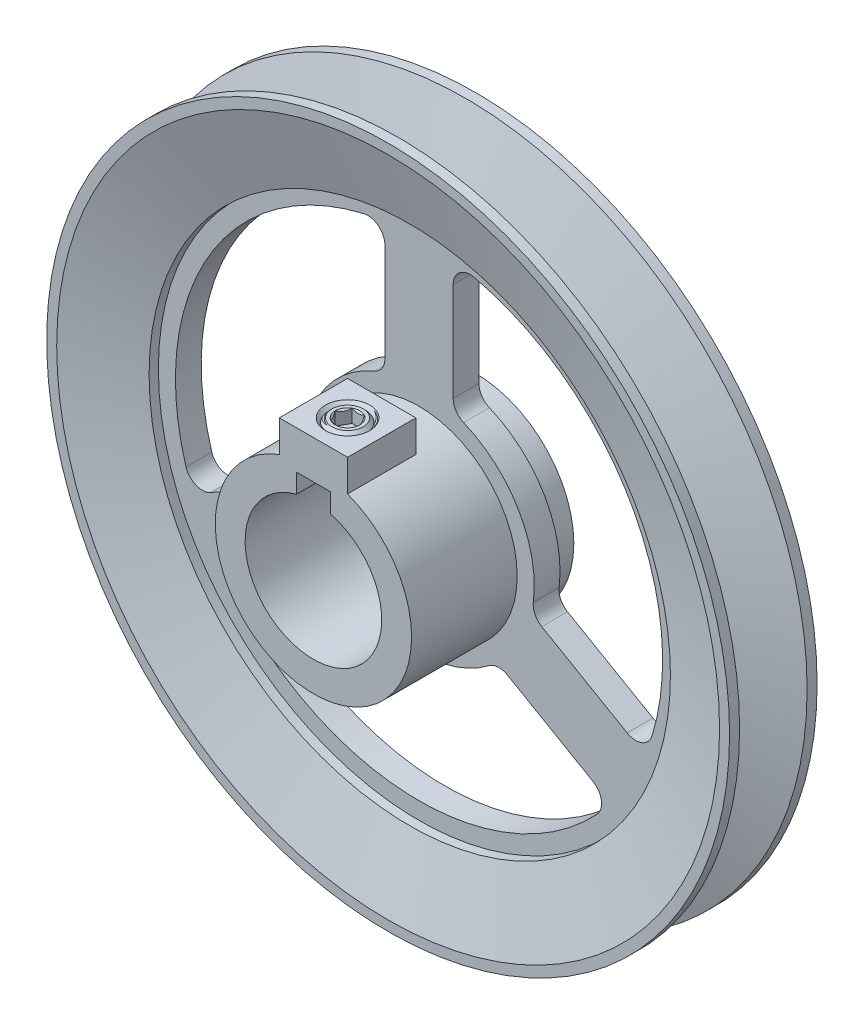
from build123d import *

# Parameters (mm, degrees)
CUT_EXTRUDE1_DEPTH       = 16.2814
CIRPATTERN1_COUNT        = 3
SKETCH3_R                = 12.7
CUT_EXTRUDE2_DEPTH       = 30.1752
SKETCH4_W                = 6.35
SKETCH4_H                = 6.35
CUT_EXTRUDE3_DEPTH       = 30.1752
BOSS_EXTRUDE1_REACH      = 112.601
BOSS_EXTRUDE1_END_RADIUS = 18.25625
BOSS_EXTRUDE1_START      = 4.7625
SKETCH5_W                = 12.7
SKETCH5_H                = 12.7
SKETCH6_R                = 3.086805556
CUT_EXTRUDE4_DEPTH       = 23.01875
CUT_SWEEP1_PITCH         = 1.411111111
CUT_SWEEP2_PITCH         = 1.411111111
CUT_EXTRUDE6_DEPTH       = 2.48046875


with BuildPart() as part:
    # Sketch1 → Revolve1 (revolve)
    with BuildSketch(Plane(origin=(0, 0, 0), x_dir=(0, 0, -1), z_dir=(1, 0, 0)), mode=Mode.PRIVATE) as revolve1_sk:
        Polygon((6.279294914, 63.5), (8.1407, 63.5), (8.1407, 61.638594914), (4.116401395, 48.475707285), (2.396515259, 48.475707285), (2.396515259, 18.25625), (8.1407, 18.25625), (8.1407, 0), (-22.0345, 0), (-22.0345, 18.25625), (-7.747, 18.25625), (-2.396515259, 18.25625), (-2.396515259, 48.475707285), (-4.116401395, 48.475707285), (-8.1407, 61.638594914), (-8.1407, 63.5), (-6.279294914, 63.5), (-2.396515259, 50.8), (2.396515259, 50.8), align=None)
    revolve(revolve1_sk.sketch.rotate(Axis((0, 0, 22.0345), (0, 0, -1)), 90), axis=Axis((0, 0, 22.0345), (0, 0, -1)))

    # Sketch2 → Cut-Extrude1 (cut)
    with BuildSketch(Plane(origin=(0, -7.9375, -8.1407), x_dir=(0, 1, 0), z_dir=(0, 0, 1))):
        with BuildLine():
            Line((-7.080606873, -38.712124137), (2.092799109, -22.823318899))
            ThreePointArc((2.092799109, -22.823318899), (3.43135905, -21.566613485), (5.241793667, -21.261035815))
            ThreePointArc((5.241793667, -21.261035815), (18.653125, -18.560006935), (27.697950293, -8.295967742))
            ThreePointArc((27.697950293, -8.295967742), (28.867805627, -6.880874207), (30.625424411, -6.35))
            Line((30.625424411, -6.35), (48.972236374, -6.35))
            ThreePointArc((48.972236374, -6.35), (51.458191388, -7.549992996), (52.065010273, -10.242895958))
            ThreePointArc((52.065010273, -10.242895958), (30.587853642, -39.231563318), (-5.255647028, -43.336992881))
            ThreePointArc((-5.255647028, -43.336992881), (-7.284359961, -41.46502083), (-7.080606873, -38.712124137))
        make_face()
    cut_extrude1 = extrude(amount=CUT_EXTRUDE1_DEPTH, mode=Mode.SUBTRACT)

    # CirPattern1: Cut-Extrude1 ×3 about axis
    cirpattern1_axis = Axis((0, 0, 0), (0, 0, 1))
    for i in range(1, CIRPATTERN1_COUNT):
        add(cut_extrude1.rotate(cirpattern1_axis, i * 360 / CIRPATTERN1_COUNT), mode=Mode.SUBTRACT)

    # Sketch3 → Cut-Extrude2 (cut)
    with BuildSketch(Plane(origin=(0, 0, -8.1407), x_dir=(-1, 0, 0), z_dir=(0, 0, -1))):
        with Locations(Location((0, 0, 0), (0, 0, 90))):
            Circle(SKETCH3_R)
    extrude(amount=-CUT_EXTRUDE2_DEPTH, mode=Mode.SUBTRACT)

    # Sketch4 → Cut-Extrude3 (cut)
    with BuildSketch(Plane(origin=(0, 0, -8.1407), x_dir=(-1, 0, 0), z_dir=(0, 0, -1))):
        with Locations((0, 12.7)):
            Rectangle(SKETCH4_W, SKETCH4_H)
    extrude(amount=-CUT_EXTRUDE3_DEPTH, mode=Mode.SUBTRACT)

    # Boss-Extrude1: up to this cylinder (the profile starts outside it)
    boss_extrude1_end = Plane(origin=(0, 0, 15.6845), z_dir=(0, 0, 1)) * Cylinder(BOSS_EXTRUDE1_END_RADIUS, 262.7145, mode=Mode.PRIVATE)
    # Sketch5 → Boss-Extrude1 (add, up to the surface)
    with BuildSketch(Plane(origin=(0, 18.25625, 0), x_dir=(-1, 0, 0), z_dir=(0, 1, 0)).offset(BOSS_EXTRUDE1_START), mode=Mode.PRIVATE) as boss_extrude1_sk1:
        with Locations((0, 15.6845)):
            Rectangle(SKETCH5_W, SKETCH5_H)
    boss_extrude1_tool1 = extrude(boss_extrude1_sk1.sketch, amount=-BOSS_EXTRUDE1_REACH, mode=Mode.PRIVATE) - boss_extrude1_end
    add(boss_extrude1_tool1.solids().sort_by_distance((0, 23.01875, 15.6845))[0])

    # Sketch6 → Cut-Extrude4 (cut)
    with BuildSketch(Plane(origin=(0, 23.01875, 0), x_dir=(-1, 0, 0), z_dir=(0, 1, 0))):
        with Locations(Location((0, 15.6845, 0), (0, 0, 90))):
            Circle(SKETCH6_R)
    extrude(amount=-CUT_EXTRUDE4_DEPTH, mode=Mode.SUBTRACT)

    # Cut-Sweep1: arcs per turn and ends read off the stored shape
    # Cut-Sweep1: the profile of Sketch8 screwed along a right-hand helix through 13.9375 turns, 8 arcs to a turn; built about Z, then put on its axis
    cut_sweep1_z = Axis((0, 0, 0), (0, 0, 1))
    cut_sweep1_corners = [(2.975827818, 0, -1.367013889), (2.975827818, 0, -0.044097222), (3.96875, 0, -0.617361111), (3.96875, 0, -0.79375)]
    with BuildLine(mode=Mode.PRIVATE) as cut_sweep1_profile:
        Line(cut_sweep1_corners[0], cut_sweep1_corners[1])
        Line(cut_sweep1_corners[1], cut_sweep1_corners[2])
        Line(cut_sweep1_corners[2], cut_sweep1_corners[3])
        Line(cut_sweep1_corners[3], cut_sweep1_corners[0])
    cut_sweep1_cap = Face(cut_sweep1_profile.wire())
    cut_sweep1_turn_angles = [0, 22.5, 45, 67.5, 90, 112.5, 135, 157.5, 180, 202.5, 225, 247.5, 270, 292.5, 315, 337.5, 360]
    cut_sweep1_turn_weights = [1, 0.9238795325112867, 1, 0.9238795325112867, 1, 0.9238795325112867, 1, 0.9238795325112867, 1, 0.9238795325112867, 1, 0.9238795325112867, 1, 0.9238795325112867, 1, 0.9238795325112867, 1]
    cut_sweep1_turn_rails = [Edge.make_bspline([Vector(p[0], p[1], 0).rotate(cut_sweep1_z, cut_sweep1_turn_angles[k]) / cut_sweep1_turn_weights[k] + Vector(0, 0, p[2] + CUT_SWEEP1_PITCH * cut_sweep1_turn_angles[k] / 360) for k in range(17)], [0, 0, 0, 1, 1, 2, 2, 3, 3, 4, 4, 5, 5, 6, 6, 7, 7, 8, 8, 8], 2, cut_sweep1_turn_weights) for p in cut_sweep1_corners]
    cut_sweep1_turn_sides = [Face.make_surface_from_curves(cut_sweep1_turn_rails[p[0]], cut_sweep1_turn_rails[p[1]]) for p in [(0, 1), (1, 2), (2, 3), (3, 0)]]
    cut_sweep1_last_angles = [4680, 4702.5, 4725, 4747.5, 4770, 4792.5, 4815, 4837.5, 4860, 4882.5, 4905, 4927.5, 4950, 4972.5, 4995, 5006.25, 5017.5]
    cut_sweep1_last_weights = [1, 0.9238795325112867, 1, 0.9238795325112867, 1, 0.9238795325112867, 1, 0.9238795325112867, 1, 0.9238795325112867, 1, 0.9238795325112867, 1, 0.9238795325112867, 1, 0.9807852804032211, 1]
    cut_sweep1_last_rails = [Edge.make_bspline([Vector(p[0], p[1], 0).rotate(cut_sweep1_z, cut_sweep1_last_angles[k]) / cut_sweep1_last_weights[k] + Vector(0, 0, p[2] + CUT_SWEEP1_PITCH * cut_sweep1_last_angles[k] / 360) for k in range(17)], [0, 0, 0, 1, 1, 2, 2, 3, 3, 4, 4, 5, 5, 6, 6, 7, 7, 8, 8, 8], 2, cut_sweep1_last_weights) for p in cut_sweep1_corners]
    cut_sweep1_last_sides = [Face.make_surface_from_curves(cut_sweep1_last_rails[p[0]], cut_sweep1_last_rails[p[1]]) for p in [(0, 1), (1, 2), (2, 3), (3, 0)]]
    cut_sweep1 = Plane(origin=(0, 23.01875, 15.6845), x_dir=(0, 0, 1), z_dir=(0, -1, 0)) * Solid(Shell([*[p.moved(Location((0, 0, CUT_SWEEP1_PITCH * i))) for i in range(13) for p in cut_sweep1_turn_sides], *cut_sweep1_last_sides, cut_sweep1_cap, cut_sweep1_cap.rotate(cut_sweep1_z, 5017.5).moved(Location((0, 0, CUT_SWEEP1_PITCH * 5017.5 / 360)))]))
    add(cut_sweep1, mode=Mode.SUBTRACT)

    # Cut-Extrude5 cone 1 section (through the dimple's axis) → Cut-Extrude5 (revolve, cut)
    with BuildSketch(Plane(origin=(0, 23.01875, 15.6845), x_dir=(0, 0, 1), z_dir=(1, 0, 0))):
        Polygon((0, 0), (4.121507259, 0), (0, 4.121507259), align=None)
    revolve(axis=Axis((0, 23.01875, 15.6845), (0, -1, 0)), mode=Mode.SUBTRACT)


with BuildPart() as body_2:
    # Sketch10 → Revolve3 (revolve)
    with BuildSketch(Plane(origin=(0, 0, 0), x_dir=(0, 0, -1), z_dir=(1, 0, 0))):
        Polygon((-19.65325, 14.563050811), (-19.65325, 21.949449189), (-18.583949189, 23.01875), (-15.6845, 23.01875), (-15.6845, 13.49375), (-18.583949189, 13.49375), align=None)
    revolve(axis=Axis((0, 23.01875, 15.6845), (0, -1, 0)))

    # Cut-Sweep2: arcs per turn and ends read off the stored shape
    # Cut-Sweep2: the profile of Sketch12 screwed along a right-hand helix through 7.75 turns, 8 arcs to a turn; built about Z, then put on its axis
    cut_sweep2_z = Axis((0, 0, 0), (0, 0, 1))
    cut_sweep2_corners = [(4.045128629, 0, -0.661458333), (4.045128629, 0, 0.661458333), (3.052206448, 0, 0.088194444), (3.052206448, 0, -0.088194444)]
    with BuildLine(mode=Mode.PRIVATE) as cut_sweep2_profile:
        Line(cut_sweep2_corners[0], cut_sweep2_corners[1])
        Line(cut_sweep2_corners[1], cut_sweep2_corners[2])
        Line(cut_sweep2_corners[2], cut_sweep2_corners[3])
        Line(cut_sweep2_corners[3], cut_sweep2_corners[0])
    cut_sweep2_cap = Face(cut_sweep2_profile.wire())
    cut_sweep2_turn_angles = [0, 22.5, 45, 67.5, 90, 112.5, 135, 157.5, 180, 202.5, 225, 247.5, 270, 292.5, 315, 337.5, 360]
    cut_sweep2_turn_weights = [1, 0.9238795325112867, 1, 0.9238795325112867, 1, 0.9238795325112867, 1, 0.9238795325112867, 1, 0.9238795325112867, 1, 0.9238795325112867, 1, 0.9238795325112867, 1, 0.9238795325112867, 1]
    cut_sweep2_turn_rails = [Edge.make_bspline([Vector(p[0], p[1], 0).rotate(cut_sweep2_z, cut_sweep2_turn_angles[k]) / cut_sweep2_turn_weights[k] + Vector(0, 0, p[2] + CUT_SWEEP2_PITCH * cut_sweep2_turn_angles[k] / 360) for k in range(17)], [0, 0, 0, 1, 1, 2, 2, 3, 3, 4, 4, 5, 5, 6, 6, 7, 7, 8, 8, 8], 2, cut_sweep2_turn_weights) for p in cut_sweep2_corners]
    cut_sweep2_turn_sides = [Face.make_surface_from_curves(cut_sweep2_turn_rails[p[0]], cut_sweep2_turn_rails[p[1]]) for p in [(0, 1), (1, 2), (2, 3), (3, 0)]]
    cut_sweep2_last_angles = [2520, 2542.5, 2565, 2587.5, 2610, 2632.5, 2655, 2677.5, 2700, 2722.5, 2745, 2767.5, 2790]
    cut_sweep2_last_weights = [1, 0.9238795325112867, 1, 0.9238795325112867, 1, 0.9238795325112867, 1, 0.9238795325112867, 1, 0.9238795325112867, 1, 0.9238795325112655, 1]
    cut_sweep2_last_rails = [Edge.make_bspline([Vector(p[0], p[1], 0).rotate(cut_sweep2_z, cut_sweep2_last_angles[k]) / cut_sweep2_last_weights[k] + Vector(0, 0, p[2] + CUT_SWEEP2_PITCH * cut_sweep2_last_angles[k] / 360) for k in range(13)], [0, 0, 0, 1, 1, 2, 2, 3, 3, 4, 4, 5, 5, 6, 6, 6], 2, cut_sweep2_last_weights) for p in cut_sweep2_corners]
    cut_sweep2_last_sides = [Face.make_surface_from_curves(cut_sweep2_last_rails[p[0]], cut_sweep2_last_rails[p[1]]) for p in [(0, 1), (1, 2), (2, 3), (3, 0)]]
    cut_sweep2 = Plane(origin=(0, 23.01875, 15.6845), x_dir=(0, 0, 1), z_dir=(0, -1, 0)) * Solid(Shell([*[p.moved(Location((0, 0, CUT_SWEEP2_PITCH * i))) for i in range(7) for p in cut_sweep2_turn_sides], *cut_sweep2_last_sides, cut_sweep2_cap, cut_sweep2_cap.rotate(cut_sweep2_z, 2790).moved(Location((0, 0, CUT_SWEEP2_PITCH * 2790 / 360)))]))
    add(cut_sweep2, mode=Mode.SUBTRACT)

    # Sketch13 → Cut-Extrude6 (cut)
    with BuildSketch(Plane(origin=(0, 23.01875, 0), x_dir=(1, 0, 0), z_dir=(0, 1, 0))):
        Polygon((2.291358881, -15.6845), (1.14567944, -13.700125), (-1.14567944, -13.700125), (-2.291358881, -15.6845), (-1.14567944, -17.668875), (1.14567944, -17.668875), align=None)
    extrude(amount=-CUT_EXTRUDE6_DEPTH, mode=Mode.SUBTRACT)

    # Cut-Extrude7 cone 1 section (through the dimple's axis) → Cut-Extrude7 (revolve, cut)
    with BuildSketch(Plane(origin=(0, 23.01875, 15.6845), x_dir=(0, 0, 1), z_dir=(1, 0, 0))):
        Polygon((0, 0), (2.291358881, 0), (0, 2.291358881), align=None)
    revolve(axis=Axis((0, 23.01875, 15.6845), (0, -1, 0)), mode=Mode.SUBTRACT)


solid = Compound([part.part, body_2.part])
